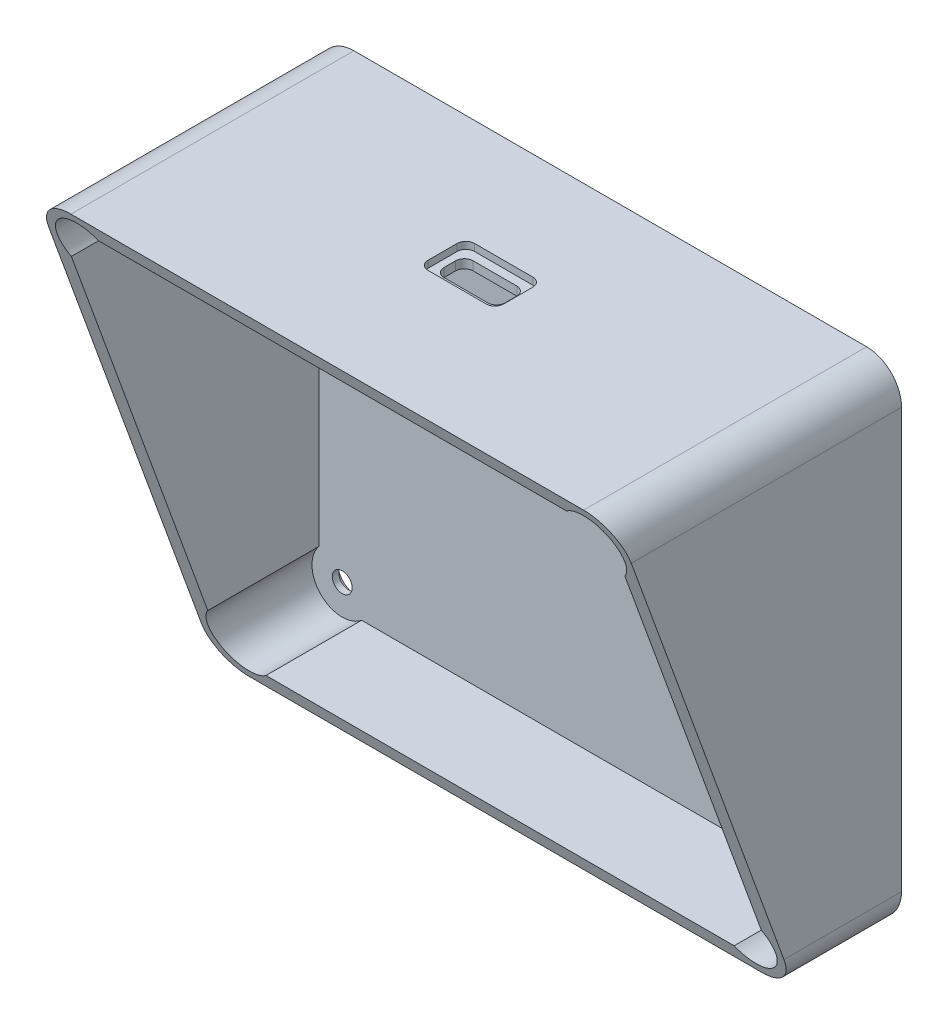
from build123d import *

# Parameters (mm, degrees)
OUTER_R6_DEPTH                           = 55
CAVITY_FLOOR2P5_WALL2P5_START            = 2.5
CAVITY_FLOOR2P5_WALL2P5_DEPTH            = 65
PANEL_SEAT_20DEG_DEPTH                   = 142.707445111
PANEL_SEAT_20DEG_DEPTH_BACK              = 142.707445111
INTERNAL_POST_CLEARANCE_0_START          = 2.5
SKETCH_4_R                               = 5.2
INTERNAL_POST_CLEARANCE_0_DEPTH          = 60
SKETCH_5_R                               = 1.7
UNDERSIDE_M3_0_DEPTH                     = 3
SKETCH_6_R                               = 3.3
UNDERSIDE_HEAD_RECESS_0_DEPTH            = 1.4
INTERNAL_POST_CLEARANCE_1_START          = 2.5
SKETCH_7_R                               = 5.2
INTERNAL_POST_CLEARANCE_1_DEPTH          = 60
SKETCH_8_R                               = 1.7
UNDERSIDE_M3_1_DEPTH                     = 3
SKETCH_9_R                               = 3.3
UNDERSIDE_HEAD_RECESS_1_DEPTH            = 1.4
INTERNAL_POST_CLEARANCE_2_START          = 2.5
SKETCH_10_R                              = 5.2
INTERNAL_POST_CLEARANCE_2_DEPTH          = 60
SKETCH_11_R                              = 1.7
UNDERSIDE_M3_2_DEPTH                     = 3
SKETCH_12_R                              = 3.3
UNDERSIDE_HEAD_RECESS_2_DEPTH            = 1.4
INTERNAL_POST_CLEARANCE_3_START          = 2.5
SKETCH_13_R                              = 5.2
INTERNAL_POST_CLEARANCE_3_DEPTH          = 60
SKETCH_14_R                              = 1.7
UNDERSIDE_M3_3_DEPTH                     = 3
SKETCH_15_R                              = 3.3
UNDERSIDE_HEAD_RECESS_3_DEPTH            = 1.4
CENTERED_CARRIER_SUPPORTS_Z7_START       = 2.5
SKETCH_16_R                              = 2.2
CENTERED_CARRIER_SUPPORTS_Z7_DEPTH       = 4.5
SKETCH_17_R                              = 1.15
CARRIER_M2_CLEARANCE_DEPTH               = 8
SKETCH_18_R                              = 2.2
CARRIER_HEAD_RECESS_DEPTH                = 1.2
USB_POCKET_BACKING_Y81P3_TO84_START      = 81.3
USB_POCKET_BACKING_Y81P3_TO84_DEPTH      = 2.7
USB_SOCKET_OPENING_10P5X5_R1P5_START     = 80.2
USB_SOCKET_OPENING_10P5X5_R1P5_DEPTH     = 5
USB_CABLE_RECESS_DEPTH1P2_FLOOR1P5_START = 82.8
USB_CABLE_RECESS_DEPTH1P2_FLOOR1P5_DEPTH = 2.2


with BuildPart() as part:
    # 草图1 → Outer_R6 (new body)
    with BuildSketch(Plane.XY):
        with BuildLine():
            Line((6, 0), (94, 0))
            ThreePointArc((94, 0), (98.242640687, 1.757359313), (100, 6))
            Line((100, 6), (100, 78))
            ThreePointArc((100, 78), (98.242640687, 82.242640687), (94, 84))
            Line((94, 84), (6, 84))
            ThreePointArc((6, 84), (1.757359313, 82.242640687), (0, 78))
            Line((0, 78), (0, 6))
            ThreePointArc((0, 6), (1.757359313, 1.757359313), (6, 0))
        make_face()
    extrude(amount=OUTER_R6_DEPTH)

    # 草图2 → Cavity_floor2p5_wall2p5 (cut)
    with BuildSketch(Plane.XY.offset(CAVITY_FLOOR2P5_WALL2P5_START)):
        with BuildLine():
            Line((6, 2.5), (94, 2.5))
            ThreePointArc((94, 2.5), (96.474873734, 3.525126266), (97.5, 6))
            Line((97.5, 6), (97.5, 78))
            ThreePointArc((97.5, 78), (96.474873734, 80.474873734), (94, 81.5))
            Line((94, 81.5), (6, 81.5))
            ThreePointArc((6, 81.5), (3.525126266, 80.474873734), (2.5, 78))
            Line((2.5, 78), (2.5, 6))
            ThreePointArc((2.5, 6), (3.525126266, 3.525126266), (6, 2.5))
        make_face()
    extrude(amount=CAVITY_FLOOR2P5_WALL2P5_DEPTH, mode=Mode.SUBTRACT)

    # 草图3 → Panel_seat_20deg (cut, two sides: drawn at the far end of the back side and taken through both)
    with BuildSketch(Plane(origin=(0, 0, 0), x_dir=(0, 0, -1), z_dir=(1, 0, 0)).offset(-PANEL_SEAT_20DEG_DEPTH_BACK)):
        Polygon((-10.720595315, -20), (-58.036725769, 110), (-120, 110), (-120, -20), align=None)
    extrude(amount=PANEL_SEAT_20DEG_DEPTH + PANEL_SEAT_20DEG_DEPTH_BACK, mode=Mode.SUBTRACT)

    # 草图4 → Internal_post_clearance_0 (cut)
    with BuildSketch(Plane.XY.offset(INTERNAL_POST_CLEARANCE_0_START)):
        with Locations((6.5, 6.5)):
            Circle(SKETCH_4_R)
    extrude(amount=INTERNAL_POST_CLEARANCE_0_DEPTH, mode=Mode.SUBTRACT)

    # 草图5 → Underside_M3_0 (cut)
    with BuildSketch(Plane.XY):
        with Locations((6.5, 6.5)):
            Circle(SKETCH_5_R)
    extrude(amount=UNDERSIDE_M3_0_DEPTH, mode=Mode.SUBTRACT)

    # 草图6 → Underside_head_recess_0 (cut)
    with BuildSketch(Plane.XY):
        with Locations((6.5, 6.5)):
            Circle(SKETCH_6_R)
    extrude(amount=UNDERSIDE_HEAD_RECESS_0_DEPTH, mode=Mode.SUBTRACT)

    # 草图7 → Internal_post_clearance_1 (cut)
    with BuildSketch(Plane.XY.offset(INTERNAL_POST_CLEARANCE_1_START)):
        with Locations((93.5, 6.5)):
            Circle(SKETCH_7_R)
    extrude(amount=INTERNAL_POST_CLEARANCE_1_DEPTH, mode=Mode.SUBTRACT)

    # 草图8 → Underside_M3_1 (cut)
    with BuildSketch(Plane.XY):
        with Locations((93.5, 6.5)):
            Circle(SKETCH_8_R)
    extrude(amount=UNDERSIDE_M3_1_DEPTH, mode=Mode.SUBTRACT)

    # 草图9 → Underside_head_recess_1 (cut)
    with BuildSketch(Plane.XY):
        with Locations((93.5, 6.5)):
            Circle(SKETCH_9_R)
    extrude(amount=UNDERSIDE_HEAD_RECESS_1_DEPTH, mode=Mode.SUBTRACT)

    # 草图10 → Internal_post_clearance_2 (cut)
    with BuildSketch(Plane.XY.offset(INTERNAL_POST_CLEARANCE_2_START)):
        with Locations((6.5, 77.5)):
            Circle(SKETCH_10_R)
    extrude(amount=INTERNAL_POST_CLEARANCE_2_DEPTH, mode=Mode.SUBTRACT)

    # 草图11 → Underside_M3_2 (cut)
    with BuildSketch(Plane.XY):
        with Locations((6.5, 77.5)):
            Circle(SKETCH_11_R)
    extrude(amount=UNDERSIDE_M3_2_DEPTH, mode=Mode.SUBTRACT)

    # 草图12 → Underside_head_recess_2 (cut)
    with BuildSketch(Plane.XY):
        with Locations((6.5, 77.5)):
            Circle(SKETCH_12_R)
    extrude(amount=UNDERSIDE_HEAD_RECESS_2_DEPTH, mode=Mode.SUBTRACT)

    # 草图13 → Internal_post_clearance_3 (cut)
    with BuildSketch(Plane.XY.offset(INTERNAL_POST_CLEARANCE_3_START)):
        with Locations((93.5, 77.5)):
            Circle(SKETCH_13_R)
    extrude(amount=INTERNAL_POST_CLEARANCE_3_DEPTH, mode=Mode.SUBTRACT)

    # 草图14 → Underside_M3_3 (cut)
    with BuildSketch(Plane.XY):
        with Locations((93.5, 77.5)):
            Circle(SKETCH_14_R)
    extrude(amount=UNDERSIDE_M3_3_DEPTH, mode=Mode.SUBTRACT)

    # 草图15 → Underside_head_recess_3 (cut)
    with BuildSketch(Plane.XY):
        with Locations((93.5, 77.5)):
            Circle(SKETCH_15_R)
    extrude(amount=UNDERSIDE_HEAD_RECESS_3_DEPTH, mode=Mode.SUBTRACT)

    # 草图16 → Centered_carrier_supports_Z7 (add)
    with BuildSketch(Plane.XY.offset(CENTERED_CARRIER_SUPPORTS_Z7_START)):
        with Locations((37, 49)):
            Circle(SKETCH_16_R)
        with Locations((63, 49)):
            Circle(SKETCH_16_R)
        with Locations((37, 78)):
            Circle(SKETCH_16_R)
        with Locations((63, 78)):
            Circle(SKETCH_16_R)
    extrude(amount=CENTERED_CARRIER_SUPPORTS_Z7_DEPTH)

    # 草图17 → Carrier_M2_clearance (cut)
    with BuildSketch(Plane.XY):
        with Locations((37, 49)):
            Circle(SKETCH_17_R)
        with Locations((63, 49)):
            Circle(SKETCH_17_R)
        with Locations((37, 78)):
            Circle(SKETCH_17_R)
        with Locations((63, 78)):
            Circle(SKETCH_17_R)
    extrude(amount=CARRIER_M2_CLEARANCE_DEPTH, mode=Mode.SUBTRACT)

    # 草图18 → Carrier_head_recess (cut)
    with BuildSketch(Plane.XY):
        with Locations((37, 49)):
            Circle(SKETCH_18_R)
        with Locations((63, 49)):
            Circle(SKETCH_18_R)
        with Locations((37, 78)):
            Circle(SKETCH_18_R)
        with Locations((63, 78)):
            Circle(SKETCH_18_R)
    extrude(amount=CARRIER_HEAD_RECESS_DEPTH, mode=Mode.SUBTRACT)

    # USB_Pocket_Backing_16x10_R2p5_Sketch → USB_Pocket_Backing_Y81p3_to84 (add)
    with BuildSketch(Plane(origin=(0, 0, 0), x_dir=(1, 0, 0), z_dir=(0, 1, 0)).offset(USB_POCKET_BACKING_Y81P3_TO84_START)):
        with BuildLine():
            Line((44.5, -27.29), (55.5, -27.29))
            ThreePointArc((55.5, -27.29), (57.267766953, -26.557766953), (58, -24.79))
            Line((58, -24.79), (58, -19.79))
            ThreePointArc((58, -19.79), (57.267766953, -18.022233047), (55.5, -17.29))
            Line((55.5, -17.29), (44.5, -17.29))
            ThreePointArc((44.5, -17.29), (42.732233047, -18.022233047), (42, -19.79))
            Line((42, -19.79), (42, -24.79))
            ThreePointArc((42, -24.79), (42.732233047, -26.557766953), (44.5, -27.29))
        make_face()
    extrude(amount=USB_POCKET_BACKING_Y81P3_TO84_DEPTH)

    # USB_Socket_Opening_10p5x5_R1p5_Sketch → USB_Socket_Opening_10p5x5_R1p5 (cut)
    with BuildSketch(Plane(origin=(0, 0, 0), x_dir=(1, 0, 0), z_dir=(0, 1, 0)).offset(USB_SOCKET_OPENING_10P5X5_R1P5_START)):
        with BuildLine():
            Line((46.25, -24.79), (53.75, -24.79))
            ThreePointArc((53.75, -24.79), (54.810660172, -24.350660172), (55.25, -23.29))
            Line((55.25, -23.29), (55.25, -21.29))
            ThreePointArc((55.25, -21.29), (54.810660172, -20.229339828), (53.75, -19.79))
            Line((53.75, -19.79), (46.25, -19.79))
            ThreePointArc((46.25, -19.79), (45.189339828, -20.229339828), (44.75, -21.29))
            Line((44.75, -21.29), (44.75, -23.29))
            ThreePointArc((44.75, -23.29), (45.189339828, -24.350660172), (46.25, -24.79))
        make_face()
    extrude(amount=USB_SOCKET_OPENING_10P5X5_R1P5_DEPTH, mode=Mode.SUBTRACT)

    # USB_Cable_Recess_13x8_R1p5_Sketch → USB_Cable_Recess_depth1p2_floor1p5 (cut)
    with BuildSketch(Plane(origin=(0, 0, 0), x_dir=(1, 0, 0), z_dir=(0, 1, 0)).offset(USB_CABLE_RECESS_DEPTH1P2_FLOOR1P5_START)):
        with BuildLine():
            Line((45, -26.29), (55, -26.29))
            ThreePointArc((55, -26.29), (56.060660172, -25.850660172), (56.5, -24.79))
            Line((56.5, -24.79), (56.5, -19.79))
            ThreePointArc((56.5, -19.79), (56.060660172, -18.729339828), (55, -18.29))
            Line((55, -18.29), (45, -18.29))
            ThreePointArc((45, -18.29), (43.939339828, -18.729339828), (43.5, -19.79))
            Line((43.5, -19.79), (43.5, -24.79))
            ThreePointArc((43.5, -24.79), (43.939339828, -25.850660172), (45, -26.29))
        make_face()
    extrude(amount=USB_CABLE_RECESS_DEPTH1P2_FLOOR1P5_DEPTH, mode=Mode.SUBTRACT)


solid = part.part
